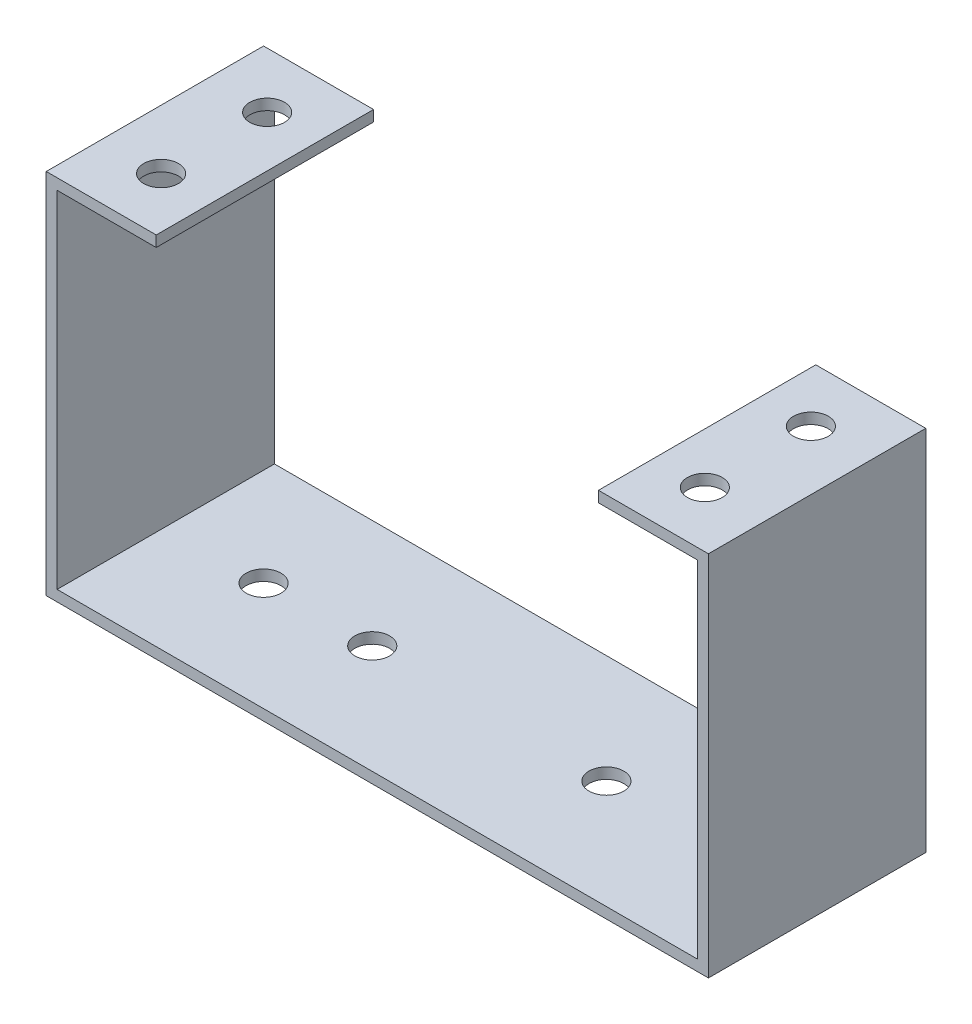
from build123d import *

# Parameters (mm, degrees)
SKETCH_2_W          = 60.94
SKETCH_2_H          = 20
EXTRUDE_1_DEPTH     = 1
SKETCH_3_W          = 1
SKETCH_3_H          = 20
EXTRUDE_2_DEPTH     = 32.81
SKETCH_4_W          = 1
SKETCH_4_H          = 20
EXTRUDE_3_DEPTH     = 32.81
SKETCH_9_W          = 20
SKETCH_9_H          = 1
EXTRUDE_8_DEPTH     = 9.12
SKETCH_10_W         = 20
SKETCH_10_H         = 1
EXTRUDE_9_DEPTH     = 9.12
SKETCH_13_R         = 1.6
CUT_EXTRUDE_2_DEPTH = 1
SKETCH_14_R         = 1.6
CUT_EXTRUDE_3_DEPTH = 1
SKETCH_15_R         = 1.6
CUT_EXTRUDE_4_DEPTH = 1
SKETCH_16_R         = 1.6
CUT_EXTRUDE_5_DEPTH = 1
SKETCH_17_R         = 1.6
CUT_EXTRUDE_6_DEPTH = 1
SKETCH_18_R         = 1.6
CUT_EXTRUDE_7_DEPTH = 1
SKETCH_19_R         = 1.6
CUT_EXTRUDE_8_DEPTH = 1


with BuildPart() as part:
    # ｽｹｯﾁ2 → ﾎﾞｽ - 押し出し1 (new body)
    with BuildSketch(Plane(origin=(0, 0, 0), x_dir=(1, 0, 0), z_dir=(0, 1, 0))):
        with Locations((30.47, 10)):
            Rectangle(SKETCH_2_W, SKETCH_2_H)
    extrude(amount=EXTRUDE_1_DEPTH)

    # ｽｹｯﾁ3 → ﾎﾞｽ - 押し出し2 (add)
    with BuildSketch(Plane(origin=(0, 1, 0), x_dir=(1, 0, 0), z_dir=(0, 1, 0))):
        with Locations((60.44, 10)):
            Rectangle(SKETCH_3_W, SKETCH_3_H)
    extrude(amount=EXTRUDE_2_DEPTH)

    # ｽｹｯﾁ4 → ﾎﾞｽ - 押し出し3 (add)
    with BuildSketch(Plane(origin=(0, 1, 0), x_dir=(1, 0, 0), z_dir=(0, 1, 0))):
        with Locations((0.5, 10)):
            Rectangle(SKETCH_4_W, SKETCH_4_H)
    extrude(amount=EXTRUDE_3_DEPTH)

    # ｽｹｯﾁ9 → ﾎﾞｽ - 押し出し8 (add)
    with BuildSketch(Plane.ZY.offset(-59.94)):
        with Locations((-10, 33.31)):
            Rectangle(SKETCH_9_W, SKETCH_9_H)
    extrude(amount=EXTRUDE_8_DEPTH)

    # ｽｹｯﾁ10 → ﾎﾞｽ - 押し出し9 (add)
    with BuildSketch(Plane(origin=(1, 0, 0), x_dir=(0, 0, -1), z_dir=(1, 0, 0))):
        with Locations((10, 33.31)):
            Rectangle(SKETCH_10_W, SKETCH_10_H)
    extrude(amount=EXTRUDE_9_DEPTH)

    # ｽｹｯﾁ13 → ｶｯﾄ - 押し出し2 (cut)
    with BuildSketch(Plane(origin=(0, 33.81, 0), x_dir=(1, 0, 0), z_dir=(0, 1, 0))):
        with Locations((55.49, 5.12)):
            Circle(SKETCH_13_R)
    extrude(amount=-CUT_EXTRUDE_2_DEPTH, mode=Mode.SUBTRACT)

    # ｽｹｯﾁ14 → ｶｯﾄ - 押し出し3 (cut)
    with BuildSketch(Plane(origin=(0, 33.81, 0), x_dir=(1, 0, 0), z_dir=(0, 1, 0))):
        with Locations((55.49, 14.88)):
            Circle(SKETCH_14_R)
    extrude(amount=-CUT_EXTRUDE_3_DEPTH, mode=Mode.SUBTRACT)

    # ｽｹｯﾁ15 → ｶｯﾄ - 押し出し4 (cut)
    with BuildSketch(Plane(origin=(0, 33.81, 0), x_dir=(1, 0, 0), z_dir=(0, 1, 0))):
        with Locations((5.45, 5.12)):
            Circle(SKETCH_15_R)
    extrude(amount=-CUT_EXTRUDE_4_DEPTH, mode=Mode.SUBTRACT)

    # ｽｹｯﾁ16 → ｶｯﾄ - 押し出し5 (cut)
    with BuildSketch(Plane(origin=(0, 33.81, 0), x_dir=(1, 0, 0), z_dir=(0, 1, 0))):
        with Locations((5.45, 14.88)):
            Circle(SKETCH_16_R)
    extrude(amount=-CUT_EXTRUDE_5_DEPTH, mode=Mode.SUBTRACT)

    # ｽｹｯﾁ17 → ｶｯﾄ - 押し出し6 (cut)
    with BuildSketch(Plane(origin=(0, 0, 0), x_dir=(-1, 0, 0), z_dir=(0, -1, 0))):
        with Locations((-41.55, 10)):
            Circle(SKETCH_17_R)
    extrude(amount=-CUT_EXTRUDE_6_DEPTH, mode=Mode.SUBTRACT)

    # ｽｹｯﾁ18 → ｶｯﾄ - 押し出し7 (cut)
    with BuildSketch(Plane(origin=(0, 0, 0), x_dir=(-1, 0, 0), z_dir=(0, -1, 0))):
        with Locations((-10, 10)):
            Circle(SKETCH_18_R)
    extrude(amount=-CUT_EXTRUDE_7_DEPTH, mode=Mode.SUBTRACT)

    # ｽｹｯﾁ19 → ｶｯﾄ - 押し出し8 (cut)
    with BuildSketch(Plane(origin=(0, 0, 0), x_dir=(-1, 0, 0), z_dir=(0, -1, 0))):
        with Locations((-20, 10)):
            Circle(SKETCH_19_R)
    extrude(amount=-CUT_EXTRUDE_8_DEPTH, mode=Mode.SUBTRACT)


solid = part.part
